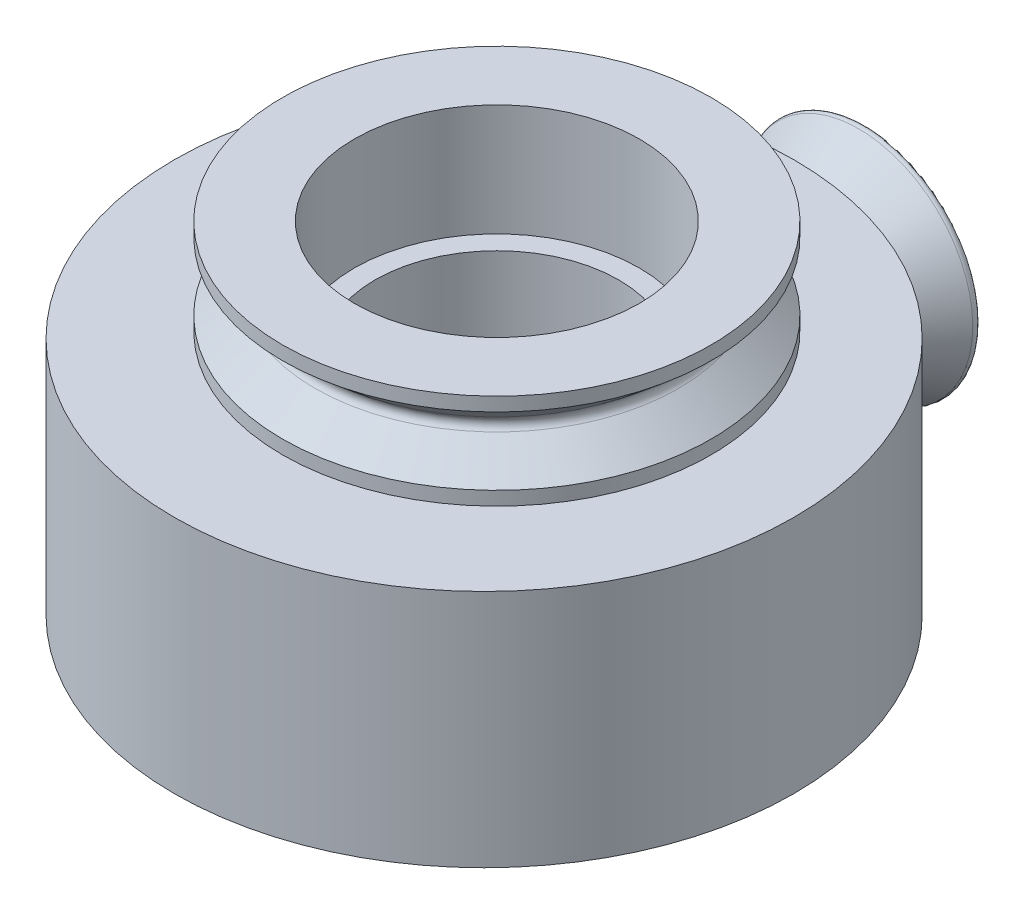
from build123d import *

# Parameters (mm, degrees)
SKETCH1_R                       = 20.65
SKETCH1_R_2                     = 12.75
BOSS_EXTRUDE1_DEPTH             = 7.975
CUT_EXTRUDE1_DEPTH              = 4.6
BOSS_EXTRUDE2_REACH             = 35.73
SKETCH5_R                       = 12.55
SKETCH5_R_2                     = 8.125
BOSS_EXTRUDE2_DIRECTION_2_REACH = 35.73
SKETCH6_R                       = 9.5
CUT_EXTRUDE2_DEPTH              = 1.1
SKETCH7_R                       = 14.2875
SKETCH7_R_2                     = 9.5
BOSS_EXTRUDE4_DEPTH             = 6.35
SKETCH9_R                       = 3
CUT_EXTRUDE3_DEPTH              = 13.97
CHAMFER1_SIZE                   = 1.016
CHAMFER1_OF_MIRROR2_SIZE        = 1.016


with BuildPart() as part:
    # Sketch1 → Boss-Extrude1 (new, symmetric)
    with BuildSketch(Plane(origin=(0, 0, 0), x_dir=(1, 0, 0), z_dir=(0, 1, 0))):
        with Locations(Location((0, 0, 0), (0, 0, 270))):
            Circle(SKETCH1_R)
        with Locations(Location((0, 0, 0), (0, 0, 270))):
            Circle(SKETCH1_R_2, mode=Mode.SUBTRACT)
    extrude(amount=BOSS_EXTRUDE1_DEPTH, both=True)

    # Sketch2 → Revolve1 (revolve)
    with BuildSketch(Plane(origin=(0, 0, 0), x_dir=(1, 0, 0), z_dir=(0, 1, 0)), mode=Mode.PRIVATE) as revolve1_sk:
        with BuildLine():
            Line((0, 25.45), (-7.35, 25.45))
            ThreePointArc((-7.35, 25.45), (-7.615766407, 25.289169741), (-7.596577614, 24.979121446))
            Line((-7.596577614, 24.979121446), (-4.2850054, 20.200525457))
            Line((-4.2850054, 20.200525457), (0, 20.200525457))
            Line((0, 20.200525457), (0, 25.45))
        make_face()
    revolve(revolve1_sk.sketch.rotate(Axis((0, 0, 23), (0, 0, -1)), 280.872235791), axis=Axis((0, 0, 23), (0, 0, -1)))

    # Sketch3 → Cut-Extrude1 (cut)
    with BuildSketch(Plane(origin=(0, 0, -25.45), x_dir=(-1, 0, 0), z_dir=(0, 0, -1))):
        Polygon((0, 2.655811238), (-2.3, 1.327905619), (-2.3, -1.327905619), (0, -2.655811238), (2.3, -1.327905619), (2.3, 1.327905619), align=None)
    extrude(amount=-CUT_EXTRUDE1_DEPTH, mode=Mode.SUBTRACT)

    # Sketch4 → Cut-Revolve2 (revolve, cut)
    with BuildSketch(Plane(origin=(0, 0, 0), x_dir=(1, 0, 0), z_dir=(0, 1, 0)), mode=Mode.PRIVATE) as cut_revolve2_sk:
        Polygon((0, 12.95), (-3.5, 12.95), (-4.45, 11.948221625), (0, 11.948221625), align=None)
    revolve(cut_revolve2_sk.sketch.rotate(Axis((0, 0, 23), (0, 0, -1)), 180), axis=Axis((0, 0, 23), (0, 0, -1)), mode=Mode.SUBTRACT)


with BuildPart() as body_2:

    # Boss-Extrude2: up to this face of the body (flat: up to its plane)
    boss_extrude2_end = Plane(part.part.faces().sort_by_distance((0, 7.975, -20.065929799))[0])
    # Sketch5 → Boss-Extrude2 (new, up to the picked face)
    with BuildSketch(Plane(origin=(0, 0, 0), x_dir=(1, 0, 0), z_dir=(0, 1, 0)), mode=Mode.PRIVATE) as boss_extrude2_sk1:
        with Locations(Location((0, 0, 0), (0, 0, 270))):
            Circle(SKETCH5_R)
        with Locations(Location((0, 0.8509, 0), (0, 0, 270))):
            Circle(SKETCH5_R_2, mode=Mode.SUBTRACT)
    boss_extrude2_tool1 = split(extrude(boss_extrude2_sk1.sketch, amount=BOSS_EXTRUDE2_REACH, mode=Mode.PRIVATE), bisect_by=boss_extrude2_end, keep=Keep.BOTH, mode=Mode.PRIVATE)
    add(boss_extrude2_tool1.solids().sort_by(Axis((0, 0, -12.195032), (0, 1, 0)))[0])


    # Boss-Extrude2 direction 2: up to this face of the body (flat: up to its plane)
    boss_extrude2_direction_2_end = Plane(part.part.faces().sort_by_distance((0, -7.975, -20.065929799))[0])
    # Sketch5 → Boss-Extrude2 direction 2 (add, up to the picked face)
    with BuildSketch(Plane(origin=(0, 0, 0), x_dir=(1, 0, 0), z_dir=(0, 1, 0)), mode=Mode.PRIVATE) as boss_extrude2_direction_2_sk1:
        with Locations(Location((0, 0, 0), (0, 0, 270))):
            Circle(SKETCH5_R)
        with Locations(Location((0, 0.8509, 0), (0, 0, 270))):
            Circle(SKETCH5_R_2, mode=Mode.SUBTRACT)
    boss_extrude2_direction_2_tool1 = split(extrude(boss_extrude2_direction_2_sk1.sketch, amount=-BOSS_EXTRUDE2_DIRECTION_2_REACH, mode=Mode.PRIVATE), bisect_by=boss_extrude2_direction_2_end, keep=Keep.BOTH, mode=Mode.PRIVATE)
    add(boss_extrude2_direction_2_tool1.solids().sort_by(Axis((0, 0, -12.195032), (0, -1, 0)))[0])

    # Sketch6 → Cut-Extrude2 (cut)
    with BuildSketch(Plane(origin=(0, 7.975, 0), x_dir=(1, 0, 0), z_dir=(0, 1, 0))):
        with Locations(Location((0, 0.8509, 0), (0, 0, 270))):
            Circle(SKETCH6_R)
    cut_extrude2 = extrude(amount=-CUT_EXTRUDE2_DEPTH, mode=Mode.SUBTRACT)

    # Mirror1: Cut-Extrude2 across plane
    add(cut_extrude2.mirror(Plane.ZX), mode=Mode.SUBTRACT)

    # Sketch7 → Boss-Extrude4 (add)
    with BuildSketch(Plane(origin=(0, 7.975, 0), x_dir=(1, 0, 0), z_dir=(0, 1, 0))):
        with Locations(Location((0, 0.8509, 0), (0, 0, 270))):
            Circle(SKETCH7_R)
        with Locations(Location((0, 0.8509, 0), (0, 0, 270))):
            Circle(SKETCH7_R_2, mode=Mode.SUBTRACT)
    extrude(amount=BOSS_EXTRUDE4_DEPTH)

    # Sketch8 → Cut-Revolve3 (revolve, cut)
    with BuildSketch(Plane(origin=(0, 0, 0), x_dir=(0, 0, -1), z_dir=(1, 0, 0)), mode=Mode.PRIVATE) as cut_revolve3_sk:
        with BuildLine():
            Line((15.1384, 13.411310764), (12.958776549, 11.58238953))
            ThreePointArc((12.958776549, 11.58238953), (12.75715, 11.15), (12.958776549, 10.71761047))
            Line((12.958776549, 10.71761047), (15.1384, 8.888689236))
            Line((15.1384, 8.888689236), (15.1384, 13.411310764))
        make_face()
    revolve(cut_revolve3_sk.sketch.rotate(Axis((0, 38.651123455, -0.8509), (0, -1, 0)), 180), axis=Axis((0, 38.651123455, -0.8509), (0, -1, 0)), mode=Mode.SUBTRACT)

    # Sketch9 → Cut-Extrude3 (cut)
    with BuildSketch(Plane(origin=(0, 0, -25.45), x_dir=(-1, 0, 0), z_dir=(0, 0, -1))):
        Circle(SKETCH9_R)
    cut_extrude3 = extrude(amount=-CUT_EXTRUDE3_DEPTH, mode=Mode.SUBTRACT)

    # Chamfer1
    # the kernel refuses this chamfer: 1.016 mm, written as the material it adds along each edge
    with BuildSketch(Plane(origin=(0, 0, -11.48), x_dir=(-1, 0, 0), z_dir=(0, -1, 0))) as chamfer1_piece_1_section:
        Polygon((3, CHAMFER1_SIZE), (3 - CHAMFER1_SIZE, 0), (3, 0), align=None)
    chamfer1_piece_1 = revolve(axis=Axis((0, 0, -11.48), (0, 0, -1)), mode=Mode.PRIVATE)
    chamfer1_piece_1 = chamfer1_piece_1 & Plane(origin=(0, 0, 0), x_dir=(0, 0, 1), z_dir=(0, -1, 0)) * Cylinder(12.55, 12, mode=Mode.PRIVATE)
    add(chamfer1_piece_1)

    # Mirror2: Cut-Extrude3 across plane
    add(cut_extrude3.mirror(Plane.XY), mode=Mode.SUBTRACT)

    # Chamfer1 of Mirror2
    # the kernel refuses this chamfer: 1.016 mm, written as the material it adds along each edge
    with BuildSketch(Plane(origin=(0, 0, 11.48), x_dir=(-1, 0, 0), z_dir=(0, -1, 0))) as chamfer1_of_mirror2_piece_1_section:
        Polygon((3, -CHAMFER1_OF_MIRROR2_SIZE), (3 - CHAMFER1_OF_MIRROR2_SIZE, 0), (3, 0), align=None)
    chamfer1_of_mirror2_piece_1 = revolve(axis=Axis((0, 0, 11.48), (0, 0, -1)), mode=Mode.PRIVATE)
    chamfer1_of_mirror2_piece_1 = chamfer1_of_mirror2_piece_1 & Plane(origin=(0, 0, 0), x_dir=(0, 0, 1), z_dir=(0, -1, 0)) * Cylinder(12.55, 12, mode=Mode.PRIVATE)
    add(chamfer1_of_mirror2_piece_1)


solid = Compound([part.part, body_2.part])
